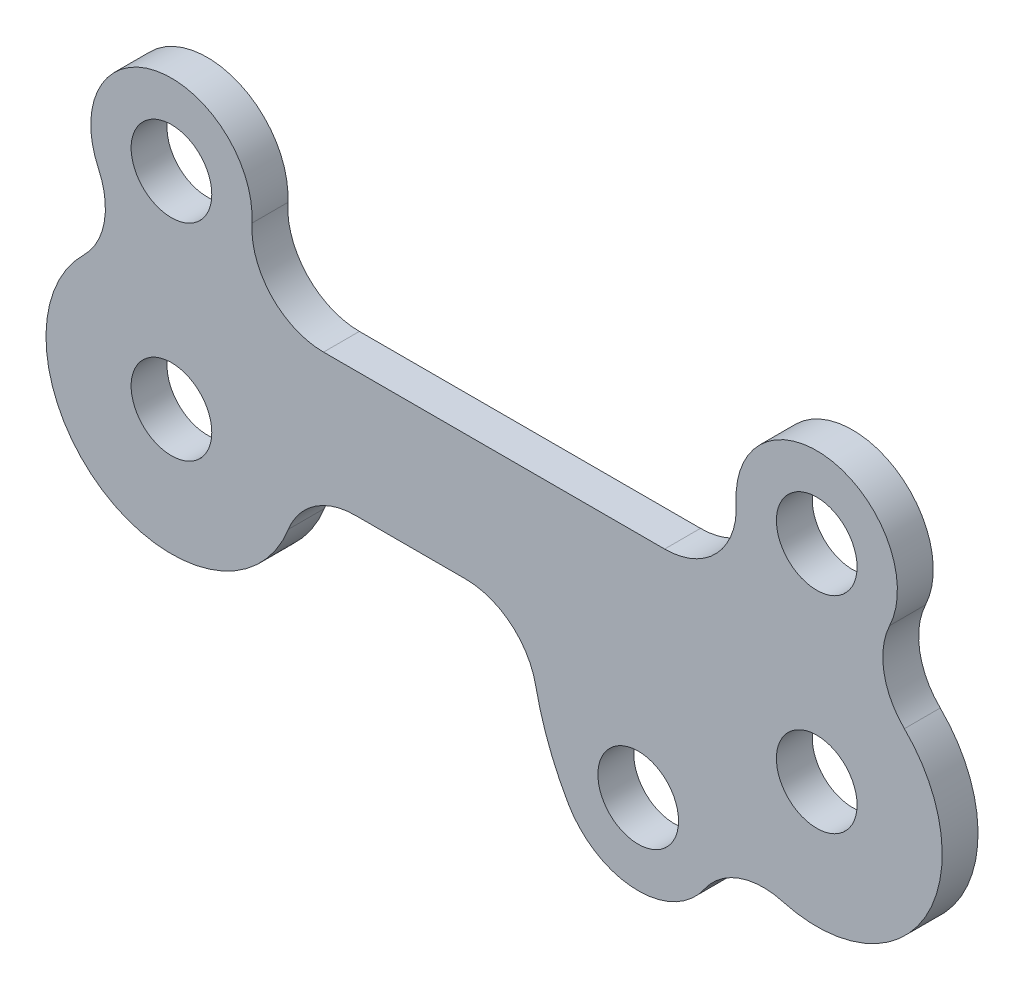
from build123d import *

# Parameters (mm, degrees)
SKETCH1_R           = 1.7859375
BOSS_EXTRUDE1_DEPTH = 1.5875
FILLET1_R           = 3.175


with BuildPart() as part:
    # Sketch1 → Boss-Extrude1 (new body)
    with BuildSketch(Plane.XY):
        with BuildLine():
            ThreePointArc((1.5875, 0), (2.020242006, -3.287001873), (3.288977372, -6.35))
            ThreePointArc((3.288977372, -6.35), (8.168249305, -7.657397022), (9.475646415, -2.778125112))
            ThreePointArc((9.475646415, -2.778125112), (17.695922725, -4.388002802), (18.16965041, 3.975024813))
            ThreePointArc((18.16965041, 3.975024813), (17.263166492, 5.684416232), (17.517188283, 7.602541632))
            ThreePointArc((17.517188283, 7.602541632), (14.966353122, 12.634896942), (10.721810076, 8.918014605))
            ThreePointArc((10.721810076, 8.918014605), (9.862459706, 6.553217935), (7.552307918, 5.55625))
            Line((7.552307918, 5.55625), (-7.552307909, 5.55625))
            ThreePointArc((-7.552307909, 5.55625), (-9.862459716, 6.553217945), (-10.721810073, 8.918014642))
            ThreePointArc((-10.721810073, 8.918014642), (-14.966353253, 12.634896917), (-17.517188185, 7.602541425))
            ThreePointArc((-17.517188185, 7.602541425), (-17.263166539, 5.68441597), (-18.169650628, 3.9750246))
            ThreePointArc((-18.169650628, 3.9750246), (-16.444084642, -5.120650031), (-8.73125, 0))
            Line((-8.73125, 0), (1.5875, 0))
        make_face()
        with Locations((14.2875, 0)):
            Circle(SKETCH1_R, mode=Mode.SUBTRACT)
        with Locations((-14.2875, 0)):
            Circle(SKETCH1_R, mode=Mode.SUBTRACT)
        with Locations((14.2875, 9.128125)):
            Circle(SKETCH1_R, mode=Mode.SUBTRACT)
        with Locations((6.382311861, -4.5640625)):
            Circle(SKETCH1_R, mode=Mode.SUBTRACT)
        with Locations((-14.2875, 9.128125)):
            Circle(SKETCH1_R, mode=Mode.SUBTRACT)
    extrude(amount=BOSS_EXTRUDE1_DEPTH)

    # Fillet1
    fillet1_edges = [part.edges().sort_by_distance(p)[0] for p in [
        (-8.73125, 0, 0.79375),
        (1.5875, 0, 0.79375),
        (9.475646415, -2.778125112, 0.79375),
    ]]
    fillet(fillet1_edges, radius=FILLET1_R)


solid = part.part
